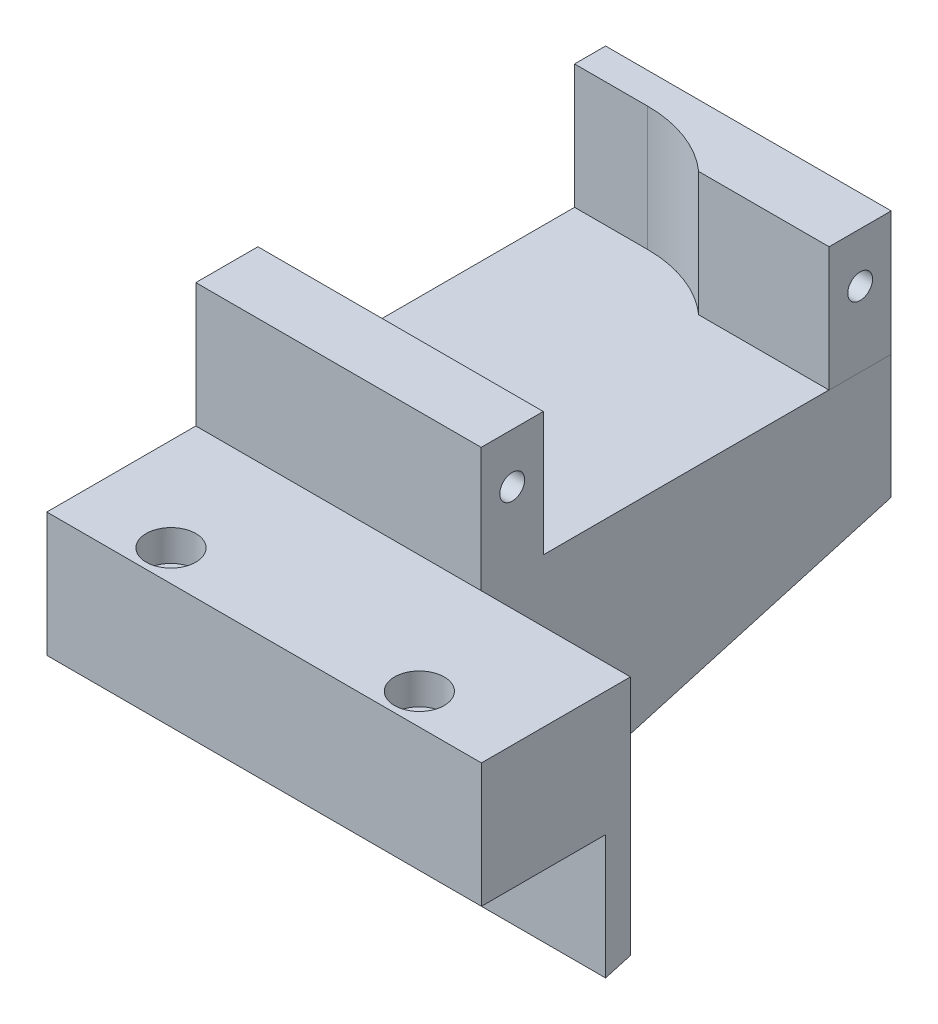
from build123d import *

# Parameters (mm, degrees)
SKETCH1_W           = 35
SKETCH1_H           = 45
SKETCH1_R           = 1.1
BOSS_EXTRUDE1_DEPTH = 10
SKETCH5_W           = 35
SKETCH5_H           = 35
BOSS_EXTRUDE3_DEPTH = 10
CUT_EXTRUDE1_DEPTH  = 50
SKETCH7_W           = 23
SKETCH7_H           = 5
BOSS_EXTRUDE4_DEPTH = 10
SKETCH8_W           = 22.981157626
SKETCH8_H           = 5
BOSS_EXTRUDE5_DEPTH = 10
SKETCH9_W           = 12.018842374
SKETCH9_H           = 33
CUT_EXTRUDE2_DEPTH  = 40
SKETCH10_R          = 1
CUT_EXTRUDE3_DEPTH  = 10
SKETCH11_R          = 1
CUT_EXTRUDE4_DEPTH  = 10
SKETCH13_W          = 2.5
SKETCH13_H          = 10
CUT_EXTRUDE6_DEPTH  = 12.5
FILLET1_R           = 10
SKETCH14_R          = 2
CUT_EXTRUDE7_DEPTH  = 2.5


with BuildPart() as part:
    # Sketch1 → Boss-Extrude1 (new body)
    with BuildSketch(Plane(origin=(0, 0, 0), x_dir=(1, 0, 0), z_dir=(0, 1, 0))):
        with Locations((0, 17.5)):
            Rectangle(SKETCH1_W, SKETCH1_H)
        with Locations(Location((-10, -2.5, 0), (0, 0, 270))):
            Circle(SKETCH1_R, mode=Mode.SUBTRACT)
        with Locations(Location((10, -2.5, 0), (0, 0, 270))):
            Circle(SKETCH1_R, mode=Mode.SUBTRACT)
    extrude(amount=BOSS_EXTRUDE1_DEPTH)

    # Sketch5 → Boss-Extrude3 (add)
    with BuildSketch(Plane.XZ):
        with Locations((0, -22.5)):
            Rectangle(SKETCH5_W, SKETCH5_H)
    extrude(amount=BOSS_EXTRUDE3_DEPTH)

    # Sketch6 → Cut-Extrude1 (cut)
    with BuildSketch(Plane(origin=(17.5, 0, 0), x_dir=(0, 0, -1), z_dir=(1, 0, 0))):
        Polygon((5, -10), (40, 0), (40, -10), align=None)
    extrude(amount=-CUT_EXTRUDE1_DEPTH, mode=Mode.SUBTRACT)

    # Sketch7 → Boss-Extrude4 (add)
    with BuildSketch(Plane(origin=(0, 10, 0), x_dir=(1, 0, 0), z_dir=(0, 1, 0))):
        with Locations((-6, 37.5)):
            Rectangle(SKETCH7_W, SKETCH7_H)
    extrude(amount=BOSS_EXTRUDE4_DEPTH)

    # Sketch8 → Boss-Extrude5 (add)
    with BuildSketch(Plane(origin=(0, 10, 0), x_dir=(1, 0, 0), z_dir=(0, 1, 0))):
        with Locations((-6.009421187, 9.5)):
            Rectangle(SKETCH8_W, SKETCH8_H)
    extrude(amount=BOSS_EXTRUDE5_DEPTH)

    # Sketch9 → Cut-Extrude2 (cut)
    with BuildSketch(Plane(origin=(0, 10, 0), x_dir=(1, 0, 0), z_dir=(0, 1, 0))):
        with Locations((11.490578813, 23.5)):
            Rectangle(SKETCH9_W, SKETCH9_H)
    extrude(amount=-CUT_EXTRUDE2_DEPTH, mode=Mode.SUBTRACT)

    # Sketch10 → Cut-Extrude3 (cut)
    with BuildSketch(Plane(origin=(5.481157626, 0, 0), x_dir=(0, 0, -1), z_dir=(1, 0, 0))):
        with Locations((9.5, 16)):
            Circle(SKETCH10_R)
    extrude(amount=-CUT_EXTRUDE3_DEPTH, mode=Mode.SUBTRACT)

    # Sketch11 → Cut-Extrude4 (cut)
    with BuildSketch(Plane(origin=(5.5, 0, 0), x_dir=(0, 0, -1), z_dir=(1, 0, 0))):
        with Locations((37.5, 16)):
            Circle(SKETCH11_R)
    extrude(amount=-CUT_EXTRUDE4_DEPTH, mode=Mode.SUBTRACT)

    # Sketch13 → Cut-Extrude6 (cut)
    with BuildSketch(Plane.ZY.offset(17.5)):
        with Locations((-36.25, 15)):
            Rectangle(SKETCH13_W, SKETCH13_H)
    extrude(amount=-CUT_EXTRUDE6_DEPTH, mode=Mode.SUBTRACT)

    # Fillet1
    # the kernel refuses this fillet: 10 mm, written as the material it adds along each edge
    with BuildSketch(Plane(origin=(-5, -6.535945694, -37.5), x_dir=(-1, 0, 0), z_dir=(0, 1, 0))) as fillet1_piece_1_section:
        with BuildLine():
            CenterArc((6.614378278, 10), FILLET1_R, 228.590377891, 41.409622109)
            Line((0, 2.5), (0, 0))
            Line((0, 0), (6.614378278, 0))
        make_face()
    fillet1_piece_1 = extrude(amount=26.535945694, mode=Mode.PRIVATE)
    fillet1_piece_1 = split(fillet1_piece_1, bisect_by=Plane(origin=(-8.071773304, 0.306036312, -41.071127093), z_dir=(0, 0.9615239476408232, 0.27472112789737807)), keep=Keep.TOP, mode=Mode.PRIVATE)
    add(fillet1_piece_1)

    # Sketch14 → Cut-Extrude7 (cut)
    with BuildSketch(Plane(origin=(0, 10, 0), x_dir=(1, 0, 0), z_dir=(0, 1, 0))):
        with Locations(Location((10, -2.5, 0), (0, 0, 270))):
            Circle(SKETCH14_R)
        with Locations(Location((-10, -2.5, 0), (0, 0, 270))):
            Circle(SKETCH14_R)
    extrude(amount=-CUT_EXTRUDE7_DEPTH, mode=Mode.SUBTRACT)


solid = part.part
